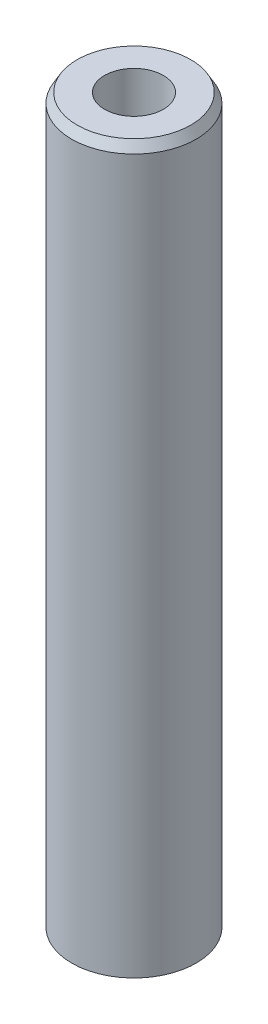
from build123d import *
from OCP.BRepFilletAPI import BRepFilletAPI_MakeChamfer

# Parameters (mm, degrees)
SKETCH1_R           = 25
BOSS_EXTRUDE1_DEPTH = 292.559721245
SKETCH2_R           = 11.804398766
CUT_EXTRUDE1_DEPTH  = 295.688293787
CHAMFER1_SIZE       = 3.800935143
CHAMFER1_SIZE2      = 2.194470928


with BuildPart() as part:
    # Sketch1 → Boss-Extrude1 (new body)
    with BuildSketch(Plane(origin=(0, 0, 0), x_dir=(1, 0, 0), z_dir=(0, 1, 0))):
        Circle(SKETCH1_R)
    extrude(amount=BOSS_EXTRUDE1_DEPTH)

    # Sketch2 → Cut-Extrude1 (cut, through all)
    with BuildSketch(Plane(origin=(0, 0, 0), x_dir=(1, 0, 0), z_dir=(0, 1, 0))):
        Circle(SKETCH2_R)
    extrude(amount=CUT_EXTRUDE1_DEPTH, mode=Mode.SUBTRACT)

    # Chamfer1: one chamfer whose edges measure the first distance from different faces: ONE call of the kernel's chamfer builder (chamfer() names one face for all edges)
    chamfer1_edges_1 = [part.edges().sort_by_distance(p)[0] for p in [
        (-25, 292.559721245, 0),
    ]]
    chamfer1_side_1 = [part.faces().sort_by_distance(p)[0] for p in [
        (-25, 146.279860623, 0),
    ]]
    chamfer1_edges_2 = [part.edges().sort_by_distance(p)[0] for p in [
        (-25, 0, 0),
    ]]
    chamfer1_side_2 = [part.faces().sort_by_distance(p)[0] for p in [
        (-24.292893219, 0, 0),
    ]]
    chamfer1 = BRepFilletAPI_MakeChamfer(part.part.solid().wrapped)
    for e in chamfer1_edges_1:
        chamfer1.Add(CHAMFER1_SIZE, CHAMFER1_SIZE2, e.wrapped, chamfer1_side_1[0].wrapped)  # the first distance lies on this face
    for e in chamfer1_edges_2:
        chamfer1.Add(CHAMFER1_SIZE, CHAMFER1_SIZE2, e.wrapped, chamfer1_side_2[0].wrapped)  # the first distance lies on this face
    add(Compound.cast(chamfer1.Shape()), mode=Mode.REPLACE)


solid = part.part
